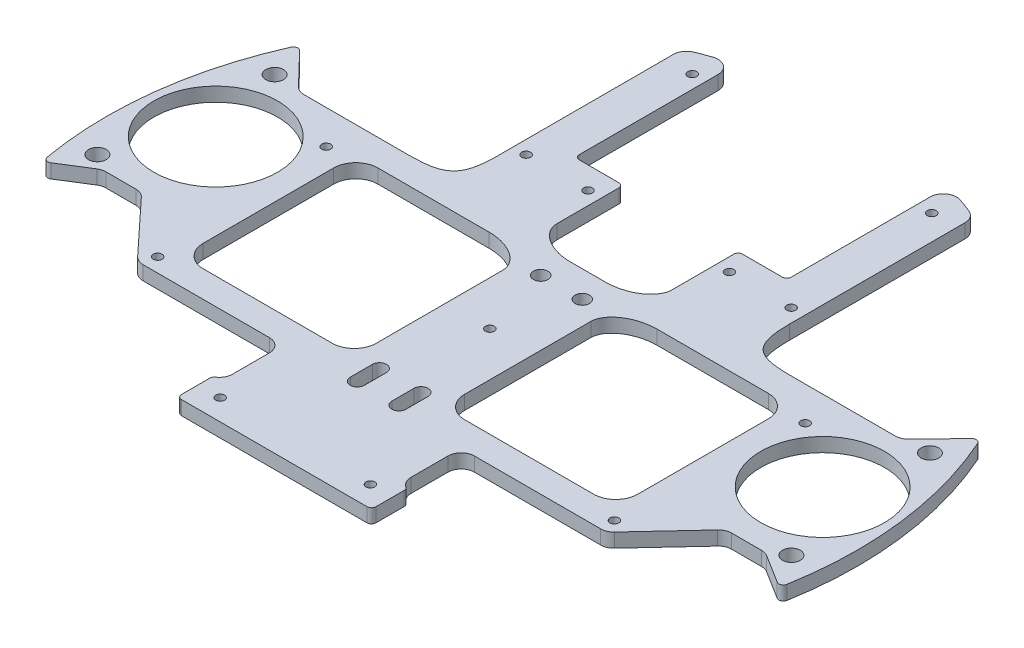
from build123d import *

# Parameters (mm, degrees)
SKETCH1_R           = 85
BOSS_EXTRUDE1_DEPTH = 3.175
CUT_EXTRUDE1_DEPTH  = 121.250075364
CUT_EXTRUDE2_DEPTH  = 121.250075364
SKETCH4_R           = 14
CUT_EXTRUDE3_DEPTH  = 118.830728696
SKETCH5_R           = 1
CUT_EXTRUDE4_DEPTH  = 118.830728696
SKETCH6_R           = 2
CUT_EXTRUDE5_DEPTH  = 118.830728696
SKETCH7_R           = 1
CUT_EXTRUDE6_DEPTH  = 118.830728696
SKETCH8_R           = 1
CUT_EXTRUDE7_DEPTH  = 118.830728696
SKETCH9_R           = 1.65
CUT_EXTRUDE8_DEPTH  = 118.830728696
SKETCH11_R          = 1
CUT_EXTRUDE9_DEPTH  = 118.830728696
SKETCH12_R          = 1
CUT_EXTRUDE10_DEPTH = 118.830728696
SKETCH13_W          = 39.185297029
SKETCH13_H          = 39.537245231
CUT_EXTRUDE11_DEPTH = 118.830728696
SKETCH14_R          = 1
CUT_EXTRUDE12_DEPTH = 118.830728696
FILLET1_R           = 3
FILLET2_R           = 1
FILLET3_SIZE        = 9
FILLET3_SIZE_2      = 6
FILLET4_SIZE        = 10
FILLET5_R           = 5


with BuildPart() as part:
    # Sketch1 → Boss-Extrude1 (new body)
    with BuildSketch(Plane(origin=(0, 0, 0), x_dir=(1, 0, 0), z_dir=(0, 1, 0))):
        with Locations(Location((0, 0, 0), (0, 0, 270))):
            Circle(SKETCH1_R)
    extrude(amount=BOSS_EXTRUDE1_DEPTH)

    # Sketch2 → Cut-Extrude1 (cut, through all)
    with BuildSketch(Plane(origin=(0, 3.175, 0), x_dir=(1, 0, 0), z_dir=(0, 1, 0))):
        with BuildLine():
            Line((24, 45), (24, 81.541400528))
            ThreePointArc((24, 81.541400528), (0, 85), (-24, 81.541400528))
            Line((-24, 81.541400528), (-24, 45))
            Line((-24, 45), (-13, 45))
            Line((-13, 45), (-13, 24))
            Line((-13, 24), (13, 24))
            Line((13, 24), (13, 45))
            Line((13, 45), (24, 45))
        make_face()
    extrude(amount=-CUT_EXTRUDE1_DEPTH, mode=Mode.SUBTRACT)

    # Sketch3 → Cut-Extrude2 (cut, through all)
    with BuildSketch(Plane(origin=(0, 3.175, 0), x_dir=(1, 0, 0), z_dir=(0, 1, 0))):
        with BuildLine():
            Line((46, -64.226162893), (46, -47))
            Line((46, -47), (-54, -47))
            Line((-54, -47), (-54, -65.642973729))
            ThreePointArc((-54, -65.642973729), (-4.950732336, -84.855702515), (46, -71.477269114))
            Line((46, -71.477269114), (46, -64.226162893))
        make_face()
        with BuildLine():
            Line((63.498031466, -47), (46, -47))
            Line((46, -47), (46, -64.226162893))
            ThreePointArc((46, -64.226162893), (55.422377211, -56.297070122), (63.498031466, -47))
        make_face()
    extrude(amount=-CUT_EXTRUDE2_DEPTH, mode=Mode.SUBTRACT)

    # Sketch4 → Cut-Extrude3 (cut, through all)
    with BuildSketch(Plane(origin=(0, 3.175, 0), x_dir=(1, 0, 0), z_dir=(0, 1, 0))):
        with Locations(Location((-68.685297029, 8.424367751, 0), (0, 0, 270))):
            Circle(SKETCH4_R)
        with Locations(Location((68.685297029, 8.424367751, 0), (0, 0, 270))):
            Circle(SKETCH4_R)
    extrude(amount=-CUT_EXTRUDE3_DEPTH, mode=Mode.SUBTRACT)

    # Sketch5 → Cut-Extrude4 (cut, through all)
    with BuildSketch(Plane(origin=(0, 3.175, 0), x_dir=(1, 0, 0), z_dir=(0, 1, 0))):
        with Locations(Location((-54.205297029, 18.944367751, 0), (0, 0, 270))):
            Circle(SKETCH5_R)
        with Locations(Location((-51.703295689, -21.695632249, 0), (0, 0, 270))):
            Circle(SKETCH5_R)
        with Locations(Location((0.004702971, 1.774367751, 0), (0, 0, 270))):
            Circle(SKETCH5_R)
        with Locations(Location((51.674702971, -21.695632249, 0), (0, 0, 270))):
            Circle(SKETCH5_R)
        with Locations(Location((54.214702971, 18.944367751, 0), (0, 0, 270))):
            Circle(SKETCH5_R)
    extrude(amount=-CUT_EXTRUDE4_DEPTH, mode=Mode.SUBTRACT)

    # Sketch6 → Cut-Extrude5 (cut, through all)
    with BuildSketch(Plane(origin=(0, 3.175, 0), x_dir=(1, 0, 0), z_dir=(0, 1, 0))):
        with Locations(Location((74.158590171, 27.230561946, 0), (0, 0, 270))):
            Circle(SKETCH6_R)
        with Locations(Location((78.541209232, -8.501673503, 0), (0, 0, 270))):
            Circle(SKETCH6_R)
        with Locations(Location((-78.541209232, -8.501673503, 0), (0, 0, 90))):
            Circle(SKETCH6_R)
        with Locations(Location((-74.158590171, 27.230561946, 0), (0, 0, 90))):
            Circle(SKETCH6_R)
    extrude(amount=-CUT_EXTRUDE5_DEPTH, mode=Mode.SUBTRACT)

    # Sketch7 → Cut-Extrude6 (cut, through all)
    with BuildSketch(Plane(origin=(0, 3.175, 0), x_dir=(1, 0, 0), z_dir=(0, 1, 0))):
        with Locations(Location((-17, -42.25, 0), (0, 0, 270))):
            Circle(SKETCH7_R)
        with Locations(Location((17, -42.25, 0), (0, 0, 270))):
            Circle(SKETCH7_R)
    extrude(amount=-CUT_EXTRUDE6_DEPTH, mode=Mode.SUBTRACT)

    # Sketch8 → Cut-Extrude7 (cut, through all)
    with BuildSketch(Plane(origin=(0, 3.175, 0), x_dir=(1, 0, 0), z_dir=(0, 1, 0))):
        with Locations(Location((-44.228070355, 47.187129244, 0), (0, 0, 270))):
            Circle(SKETCH8_R)
        with Locations(Location((-55.025439175, 36.774789135, 0), (0, 0, 270))):
            Circle(SKETCH8_R)
        with Locations(Location((-54.744489626, -35.3653201, 0), (0, 0, 270))):
            Circle(SKETCH8_R)
        with Locations(Location((-62.705485942, -22.652234807, 0), (0, 0, 270))):
            Circle(SKETCH8_R)
        with Locations(Location((62.705485942, -22.652234807, 0), (0, 0, 90))):
            Circle(SKETCH8_R)
        with Locations(Location((54.744489626, -35.3653201, 0), (0, 0, 90))):
            Circle(SKETCH8_R)
        with Locations(Location((55.025439175, 36.774789135, 0), (0, 0, 90))):
            Circle(SKETCH8_R)
        with Locations(Location((44.228070355, 47.187129244, 0), (0, 0, 90))):
            Circle(SKETCH8_R)
    extrude(amount=-CUT_EXTRUDE7_DEPTH, mode=Mode.SUBTRACT)

    # Sketch9 → Cut-Extrude8 (cut, through all)
    with BuildSketch(Plane(origin=(0, 3.175, 0), x_dir=(1, 0, 0), z_dir=(0, 1, 0))):
        with Locations(Location((-4.7, 18, 0), (0, 0, 270))):
            Circle(SKETCH9_R)
        with Locations(Location((4.7, 18, 0), (0, 0, 270))):
            Circle(SKETCH9_R)
        with BuildLine():
            Line((-6.3, -23.5), (-6.3, -18.5))
            ThreePointArc((-6.3, -18.5), (-4.7, -16.9), (-3.1, -18.5))
            Line((-3.1, -18.5), (-3.1, -23.5))
            ThreePointArc((-3.1, -23.5), (-4.7, -25.1), (-6.3, -23.5))
        make_face()
        with BuildLine():
            Line((3.1, -23.5), (3.1, -18.5))
            ThreePointArc((3.1, -18.5), (4.7, -16.9), (6.3, -18.5))
            Line((6.3, -18.5), (6.3, -23.5))
            ThreePointArc((6.3, -23.5), (4.7, -25.1), (3.1, -23.5))
        make_face()
    extrude(amount=-CUT_EXTRUDE8_DEPTH, mode=Mode.SUBTRACT)

    # Sketch11 → Cut-Extrude9 (cut, through all)
    # profile 1 of 4: a face of its own
    with BuildSketch(Plane(origin=(0, 3.175, 0), x_dir=(1, 0, 0), z_dir=(0, 1, 0))):
        with BuildLine():
            Line((-33, 26.630858487), (-33, 78.33262411))
            ThreePointArc((-33, 78.33262411), (-58.995216162, 61.192846559), (-77.073860284, 35.841596796))
            Line((-77.073860284, 35.841596796), (-68.191572245, 26.630858487))
            Line((-68.191572245, 26.630858487), (-33, 26.630858487))
        make_face()
        with Locations((-55.025439175, 36.774789135)):
            Circle(SKETCH11_R, mode=Mode.SUBTRACT)
        with Locations((-44.228070355, 47.187129244)):
            Circle(SKETCH11_R, mode=Mode.SUBTRACT)
    # profile 2 of 4: a face of its own
    with BuildSketch(Plane(origin=(0, 3.175, 0), x_dir=(1, 0, 0), z_dir=(0, 1, 0))):
        with BuildLine():
            Line((-75.072742311, -10.906386744), (-83.451078309, -16.152941807))
            ThreePointArc((-83.451078309, -16.152941807), (-73.044613402, -43.46820048), (-54, -65.642973729))
            Line((-54, -65.642973729), (-54, -47))
            Line((-54, -47), (-22, -47))
            Line((-22, -47), (-22, -39))
            Line((-22, -39), (-20.205297029, -39))
            Line((-20.205297029, -39), (-20.205297029, -24.906386744))
            Line((-20.205297029, -24.906386744), (-53.091478023, -24.906386744))
            Line((-53.091478023, -24.906386744), (-66.121719331, -10.906386744))
            Line((-66.121719331, -10.906386744), (-75.072742311, -10.906386744))
        make_face()
        with Locations((-54.744489626, -35.3653201)):
            Circle(SKETCH11_R, mode=Mode.SUBTRACT)
        with Locations((-62.705485942, -22.652234807)):
            Circle(SKETCH11_R, mode=Mode.SUBTRACT)
    # profile 3 of 4: a face of its own
    with BuildSketch(Plane(origin=(0, 3.175, 0), x_dir=(1, 0, 0), z_dir=(0, 1, 0))):
        with BuildLine():
            Line((22, -39), (22, -47))
            Line((22, -47), (63.498031466, -47))
            ThreePointArc((63.498031466, -47), (55.422377211, -56.297070122), (46, -64.226162893))
            Line((46, -64.226162893), (46, -71.477269114))
            ThreePointArc((46, -71.477269114), (70.388853641, -47.648811981), (83.451078309, -16.152941807))
            Line((83.451078309, -16.152941807), (75.072742311, -10.906386744))
            Line((75.072742311, -10.906386744), (66.121719331, -10.906386744))
            Line((66.121719331, -10.906386744), (53.091478023, -24.906386744))
            Line((53.091478023, -24.906386744), (20.205297029, -24.906386744))
            Line((20.205297029, -24.906386744), (20.205297029, -39))
            Line((20.205297029, -39), (22, -39))
        make_face()
        with Locations((54.744489626, -35.3653201)):
            Circle(SKETCH11_R, mode=Mode.SUBTRACT)
        with Locations((62.705485942, -22.652234807)):
            Circle(SKETCH11_R, mode=Mode.SUBTRACT)
    # profile 4 of 4: a face of its own
    with BuildSketch(Plane(origin=(0, 3.175, 0), x_dir=(1, 0, 0), z_dir=(0, 1, 0))):
        with BuildLine():
            ThreePointArc((77.073860284, 35.841596796), (58.995216162, 61.192846559), (33, 78.33262411))
            Line((33, 78.33262411), (33, 26.630858487))
            Line((33, 26.630858487), (68.191572245, 26.630858487))
            Line((68.191572245, 26.630858487), (77.073860284, 35.841596796))
        make_face()
        with Locations((55.025439175, 36.774789135)):
            Circle(SKETCH11_R, mode=Mode.SUBTRACT)
        with Locations((44.228070355, 47.187129244)):
            Circle(SKETCH11_R, mode=Mode.SUBTRACT)
    extrude(amount=-CUT_EXTRUDE9_DEPTH, mode=Mode.SUBTRACT)

    # Sketch12 → Cut-Extrude10 (cut, through all)
    with BuildSketch(Plane(origin=(0, 3.175, 0), x_dir=(1, 0, 0), z_dir=(0, 1, 0))):
        with Locations(Location((-27, 74.597766718, 0), (0, 0, 270))):
            Circle(SKETCH12_R)
        with Locations(Location((27.361579834, 74.452925447, 0), (0, 0, 270))):
            Circle(SKETCH12_R)
    extrude(amount=-CUT_EXTRUDE10_DEPTH, mode=Mode.SUBTRACT)

    # Sketch13 → Cut-Extrude11 (cut, through all)
    with BuildSketch(Plane(origin=(0, 3.175, 0), x_dir=(1, 0, 0), z_dir=(0, 1, 0))):
        with Locations((-29.592648515, 0.862235871)):
            Rectangle(SKETCH13_W, SKETCH13_H)
        with Locations((29.592648515, 0.862235871)):
            Rectangle(SKETCH13_W, SKETCH13_H)
    extrude(amount=-CUT_EXTRUDE11_DEPTH, mode=Mode.SUBTRACT)

    # Sketch14 → Cut-Extrude12 (cut, through all)
    with BuildSketch(Plane(origin=(0, 3.175, 0), x_dir=(1, 0, 0), z_dir=(0, 1, 0))):
        with Locations(Location((-30, 40, 0), (0, 0, 270))):
            Circle(SKETCH14_R)
        with Locations(Location((30, 40, 0), (0, 0, 90))):
            Circle(SKETCH14_R)
        with Locations(Location((-16, 40, 0), (0, 0, 90))):
            Circle(SKETCH14_R)
        with Locations(Location((16, 40, 0), (0, 0, 270))):
            Circle(SKETCH14_R)
    extrude(amount=-CUT_EXTRUDE12_DEPTH, mode=Mode.SUBTRACT)

    # Fillet1
    # the kernel refuses this fillet: 3 mm, written as the material it adds along each edge
    with BuildSketch(Plane(origin=(68.191572245, 3.175, -26.630858487), x_dir=(-1, 0, 0), z_dir=(0, -1, 0))) as fillet1_piece_1:
        with BuildLine():
            CenterArc((FILLET1_R * 0.424886837416, FILLET1_R), FILLET1_R, 223.96, 46.04)
            Line((-FILLET1_R * 0.294937750614, FILLET1_R * 0.305843992702), (0, 0))
            Line((0, 0), (FILLET1_R * 0.424886837416, 0))
        make_face()
    extrude(amount=3.175)
    with BuildSketch(Plane(origin=(-68.191572245, 3.175, -26.630858487), x_dir=(1, 0, 0), z_dir=(0, -1, 0))) as fillet1_piece_2:
        with BuildLine():
            CenterArc((FILLET1_R * 0.424886837416, -FILLET1_R), FILLET1_R, 90, 46.04)
            Line((-FILLET1_R * 0.294937750614, -FILLET1_R * 0.305843992702), (0, 0))
            Line((0, 0), (FILLET1_R * 0.424886837416, 0))
        make_face()
    extrude(amount=3.175)
    with BuildSketch(Plane(origin=(-75.072742311, 3.175, 10.906386744), x_dir=(-0.8475390195339324, 0, 0.5307330876885862), z_dir=(0, -1, 0))) as fillet1_piece_3:
        with BuildLine():
            CenterArc((FILLET1_R * 0.287264887008, -FILLET1_R), FILLET1_R, 90, 32.055)
            Line((-FILLET1_R * 0.243468200681, -FILLET1_R * 0.152460980466), (0, 0))
            Line((0, 0), (FILLET1_R * 0.287264887008, 0))
        make_face()
    extrude(amount=3.175)
    with BuildSketch(Plane(origin=(-66.121719331, 3.175, 10.906386744), x_dir=(-1, 0, 0), z_dir=(0, -1, 0))) as fillet1_piece_4:
        with BuildLine():
            CenterArc((FILLET1_R * 0.435380174047, -FILLET1_R), FILLET1_R, 90, 47.054708234)
            Line((-FILLET1_R * 0.296624392579, -FILLET1_R * 0.318700275621), (0, 0))
            Line((0, 0), (FILLET1_R * 0.435380174047, 0))
        make_face()
    extrude(amount=3.175)
    with BuildSketch(Plane(origin=(-20.205297029, 3.175, 39), x_dir=(0, 0, -1), z_dir=(0, -1, 0))) as fillet1_piece_5:
        with BuildLine():
            CenterArc((2.747227525, -3), FILLET1_R, 90, 66.311394067)
            Line((0, -1.794702971), (0, 0))
            Line((0, 0), (2.747227525, 0))
        make_face()
    extrude(amount=3.175)
    with BuildSketch(Plane(origin=(20.205297029, 3.175, 39), x_dir=(1, 0, 0), z_dir=(0, -1, 0))) as fillet1_piece_6:
        with BuildLine():
            CenterArc((3, -2.747227525), FILLET1_R, 113.688605933, 66.311394067)
            Line((0, -2.747227525), (0, 0))
            Line((0, 0), (1.794702971, 0))
        make_face()
    extrude(amount=3.175)
    with BuildSketch(Plane(origin=(20.205297029, 3.175, 24.906386744), x_dir=(1, 0, 0), z_dir=(0, -1, 0))) as fillet1_piece_7:
        with BuildLine():
            CenterArc((FILLET1_R, FILLET1_R), FILLET1_R, 180, 90)
            Line((0, FILLET1_R), (0, 0))
            Line((0, 0), (FILLET1_R, 0))
        make_face()
    extrude(amount=3.175)
    with BuildSketch(Plane(origin=(66.121719331, 3.175, 10.906386744), x_dir=(1, 0, 0), z_dir=(0, -1, 0))) as fillet1_piece_8:
        with BuildLine():
            CenterArc((FILLET1_R * 0.435380174047, FILLET1_R), FILLET1_R, 222.945291766, 47.054708234)
            Line((-FILLET1_R * 0.296624392579, FILLET1_R * 0.318700275621), (0, 0))
            Line((0, 0), (FILLET1_R * 0.435380174047, 0))
        make_face()
    extrude(amount=3.175)
    with BuildSketch(Plane(origin=(75.072742311, 3.175, 10.906386744), x_dir=(0.8475390195339343, 0, 0.5307330876885832), z_dir=(0, -1, 0))) as fillet1_piece_9:
        with BuildLine():
            CenterArc((FILLET1_R * 0.287264887008, FILLET1_R), FILLET1_R, 237.945, 32.055)
            Line((-FILLET1_R * 0.243468200681, FILLET1_R * 0.152460980466), (0, 0))
            Line((0, 0), (FILLET1_R * 0.287264887008, 0))
        make_face()
    extrude(amount=3.175)
    with BuildSketch(Plane(origin=(-20.205297029, 3.175, 24.906386744), x_dir=(-1, 0, 0), z_dir=(0, -1, 0))) as fillet1_piece_10:
        with BuildLine():
            CenterArc((FILLET1_R, -FILLET1_R), FILLET1_R, 90, 90)
            Line((0, -FILLET1_R), (0, 0))
            Line((0, 0), (FILLET1_R, 0))
        make_face()
    extrude(amount=3.175)
    # the kernel refuses this fillet: 3 mm, written as the material it takes off along each edge
    with BuildSketch(Plane(origin=(24, 13.646488892, -81.541400528), x_dir=(0, 0, 1), z_dir=(0, -1, 0))) as fillet1_2_piece_1:
        with BuildLine():
            CenterArc((4.114015191, -3), FILLET1_R, 90, 109.224369863)
            ThreePointArc((1.281305972, -3.987804878), (0.616085578, -2.001796097), (0, 0))
            Line((0, 0), (4.114015191, 0))
        make_face()
    extrude(amount=24.117977784, mode=Mode.SUBTRACT)
    with BuildSketch(Plane(origin=(-24, 13.646488892, -81.541400528), x_dir=(-0.952062528822469, 0, 0.30590348349138674), z_dir=(0, -1, 0))) as fillet1_2_piece_2:
        with BuildLine():
            CenterArc((4.114679165, -2.999089256), FILLET1_R, 88.588158025, 109.224369863)
            Line((1.258491578, -3.916799707), (0, 0))
            ThreePointArc((0, 0), (2.094297778, 0.025804406), (4.188595557, 0))
        make_face()
    extrude(amount=24.117977784, mode=Mode.SUBTRACT)
    with BuildSketch(Plane(origin=(33, 8.310154385, -78.33262411), x_dir=(-0.9261839478436628, 0, -0.3770720020854471), z_dir=(0, -1, 0))) as fillet1_2_piece_3:
        with BuildLine():
            CenterArc((2.017813605, -2.999781004), FILLET1_R, 89.307694511, 68.539872251)
            Line((-0.760738238, -1.868564998), (0, 0))
            ThreePointArc((0, 0), (1.027030877, 0.006204888), (2.054061754, 0))
        make_face()
    extrude(amount=13.44530877, mode=Mode.SUBTRACT)
    with BuildSketch(Plane(origin=(-33, 8.310154385, -78.33262411), x_dir=(0.9261839478436659, 0, -0.37707200208543945), z_dir=(0, -1, 0))) as fillet1_2_piece_4:
        with BuildLine():
            CenterArc((2.017813605, 2.999781004), FILLET1_R, 202.152433239, 68.539872251)
            Line((-0.760738238, 1.868564998), (0, 0))
            ThreePointArc((0, 0), (1.027030877, -0.006204888), (2.054061754, 0))
        make_face()
    extrude(amount=13.44530877, mode=Mode.SUBTRACT)
    with BuildSketch(Plane(origin=(53.091478023, 6.440351305, 24.906386744), x_dir=(0.6812997243789076, 0, -0.732004566625936), z_dir=(0, -1, 0))) as fillet1_2_piece_5:
        with BuildLine():
            CenterArc((FILLET1_R * 0.435380174047, -FILLET1_R), FILLET1_R, 90, 47.054708234)
            Line((-FILLET1_R * 0.296624392579, -FILLET1_R * 0.318700275621), (0, 0))
            Line((0, 0), (FILLET1_R * 0.435380174047, 0))
        make_face()
    extrude(amount=9.705702611, mode=Mode.SUBTRACT)
    with BuildSketch(Plane(origin=(-53.091478023, 6.440351305, 24.906386744), x_dir=(-0.6812997243789063, 0, -0.7320045666259374), z_dir=(0, -1, 0))) as fillet1_2_piece_6:
        with BuildLine():
            CenterArc((FILLET1_R * 0.435380174047, FILLET1_R), FILLET1_R, 222.945291766, 47.054708234)
            Line((-FILLET1_R * 0.296624392579, FILLET1_R * 0.318700275621), (0, 0))
            Line((0, 0), (FILLET1_R * 0.435380174047, 0))
        make_face()
    extrude(amount=9.705702611, mode=Mode.SUBTRACT)

    # Fillet2
    fillet2_edges = [part.edges().sort_by_distance(p)[0] for p in [
        (24, 1.5875, -45),
        (13, 1.5875, -45),
        (-13, 1.5875, -45),
        (-24, 1.5875, -45),
        (22, 1.5875, 47),
        (-22, 1.5875, 47),
        (77.073860284, 1.5875, -35.841596796),
        (-22, 1.5875, 39),
        (-83.451078309, 1.5875, 16.152941807),
        (22, 1.5875, 39),
        (83.451078309, 1.5875, 16.152941807),
        (-77.073860284, 1.5875, -35.841596796),
    ]]
    fillet(fillet2_edges, radius=FILLET2_R)

    # Fillet3
    # a fillet whose section is not a circle: 9, 6 mm, written as the material it adds along each edge
    with BuildSketch(Plane(origin=(10, 3.175, -20.630858487), x_dir=(1, 0, 0), z_dir=(0, -1, 0)), Plane(origin=(13, 3.175, -24), x_dir=(-1, 0, 0), z_dir=(0, -1, 0))) as fillet3_piece_1:
        with BuildLine():
            Bezier((FILLET3_SIZE, 0), (0, 0), (0, FILLET3_SIZE_2), weights=[1, 0.666666667, 1])
            Line((0, FILLET3_SIZE_2), (0, 0))
            Line((0, 0), (FILLET3_SIZE, 0))
        make_face()
    extrude(amount=3.175)
    with BuildSketch(Plane(origin=(-10, 3.175, -20.630858487), x_dir=(-1, 0, 0), z_dir=(0, -1, 0))) as fillet3_piece_2:
        with BuildLine():
            Bezier((FILLET3_SIZE, 0), (0, 0), (0, -FILLET3_SIZE_2), weights=[1, 0.666666667, 1])
            Line((0, -FILLET3_SIZE_2), (0, 0))
            Line((0, 0), (FILLET3_SIZE, 0))
        make_face()
    extrude(amount=3.175)
    with BuildSketch(Plane(origin=(-13, 3.175, -24), x_dir=(0, 0, -1), z_dir=(0, -1, 0))) as fillet3_piece_3:
        with BuildLine():
            Bezier((FILLET3_SIZE_2, 0), (0, 0), (0, FILLET3_SIZE), weights=[1, 0.666666667, 1])
            Line((0, FILLET3_SIZE), (0, 0))
            Line((0, 0), (FILLET3_SIZE_2, 0))
        make_face()
    extrude(amount=3.175)

    # Fillet4
    # a fillet whose section is not a circle: 10 mm, written as the material it adds along each edge
    with BuildSketch(Plane(origin=(33, 3.175, -26.630858487), x_dir=(1, 0, 0), z_dir=(0, -1, 0)), Plane(origin=(-33, 3.175, -26.630858487), x_dir=(0, 0, -1), z_dir=(0, -1, 0))) as fillet4_piece_1:
        with BuildLine():
            Bezier((FILLET4_SIZE, 0), (0, 0), (0, -FILLET4_SIZE), weights=[1, 1.5, 1])
            Line((0, -FILLET4_SIZE), (0, 0))
            Line((0, 0), (FILLET4_SIZE, 0))
        make_face()
    extrude(amount=3.175)

    # Fillet5
    fillet5_edges = [part.edges().sort_by_distance(p)[0] for p in [
        (49.185297029, 1.5875, -20.630858487),
        (49.185297029, 1.5875, 18.906386744),
        (10, 1.5875, 18.906386744),
        (-10, 1.5875, 18.906386744),
        (-49.185297029, 1.5875, 18.906386744),
        (-49.185297029, 1.5875, -20.630858487),
    ]]
    fillet(fillet5_edges, radius=FILLET5_R)


solid = part.part
